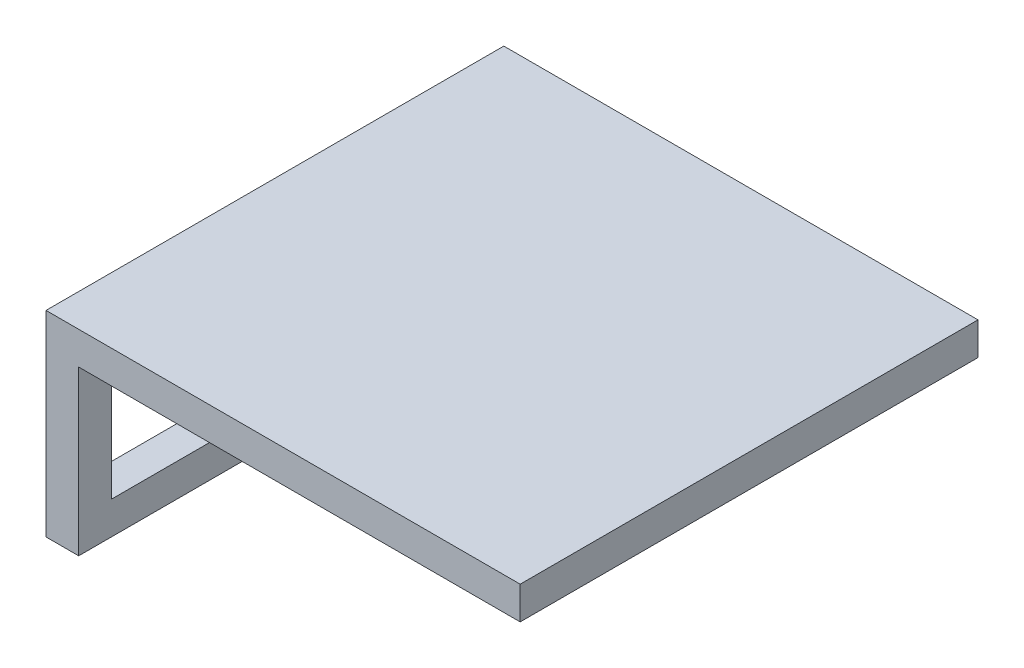
from build123d import *

# Parameters (mm, degrees)
BOSS_EXTRUDE1_DEPTH = 35
SKETCH2_R           = 1
CUT_EXTRUDE1_DEPTH  = 10
SKETCH3_W           = 60
SKETCH3_H           = 20
CUT_EXTRUDE2_DEPTH  = 10


with BuildPart() as part:
    # Sketch1 → Boss-Extrude1 (new, symmetric)
    with BuildSketch(Plane.XY):
        Polygon((-5, 0), (0, 0), (0, 25), (67.5, 25), (67.5, 30), (-5, 30), align=None)
    extrude(amount=BOSS_EXTRUDE1_DEPTH, both=True)

    # Sketch2 → Cut-Extrude1 (cut)
    with BuildSketch(Plane.XZ):
        with Locations((-2.5, 10)):
            Circle(SKETCH2_R)
        with Locations((-2.5, -10)):
            Circle(SKETCH2_R)
    extrude(amount=-CUT_EXTRUDE1_DEPTH, mode=Mode.SUBTRACT)

    # Sketch3 → Cut-Extrude2 (cut)
    with BuildSketch(Plane.ZY.offset(5)):
        with Locations((0, 15)):
            Rectangle(SKETCH3_W, SKETCH3_H)
    extrude(amount=-CUT_EXTRUDE2_DEPTH, mode=Mode.SUBTRACT)


solid = part.part
